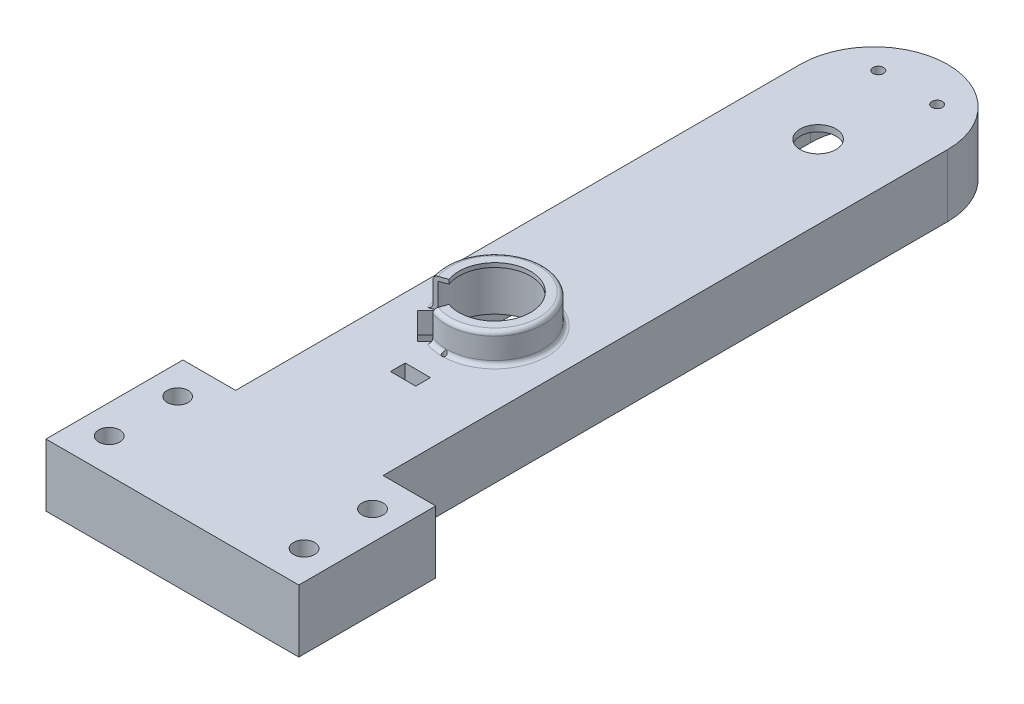
from build123d import *

# Parameters (mm, degrees)
BOSS_EXTRUDE1_DEPTH = 10
BOSS_EXTRUDE2_START = -3
SKETCH2_R           = 3.5
SKETCH2_R_2         = 7.5
BOSS_EXTRUDE2_DEPTH = 3
BOSS_EXTRUDE5_START = -3
BOSS_EXTRUDE5_DEPTH = 10
SKETCH6_R           = 8.5
CUT_EXTRUDE1_DEPTH  = 246.440929757
SKETCH7_R           = 1
CUT_EXTRUDE2_DEPTH  = 246.544802429
BOSS_EXTRUDE6_DEPTH = 22
BOSS_EXTRUDE7_DEPTH = 2
FILLET1_R           = 2
FILLET3_R           = 2
SKETCH11_W          = 12
SKETCH11_H          = 7
CUT_EXTRUDE3_DEPTH  = 247.512170095
BOSS_EXTRUDE8_START = -10
BOSS_EXTRUDE8_DEPTH = 29.65
SKETCH13_R          = 2.5
CUT_EXTRUDE4_DEPTH  = 250.845097028
SKETCH14_W          = 120
SKETCH14_H          = 65
SKETCH14_R          = 5
BOSS_EXTRUDE9_DEPTH = 29.65
SKETCH15_W          = 60
SKETCH15_H          = 55
CUT_EXTRUDE5_DEPTH  = 19.65


with BuildPart() as part:
    # Sketch1 → Boss-Extrude1 (new body)
    with BuildSketch(Plane(origin=(0, 0, 0), x_dir=(1, 0, 0), z_dir=(0, 1, 0))):
        with BuildLine():
            Line((30, 26.5), (30, -243.5))
            Line((30, -243.5), (-30, -243.5))
            Line((-30, -243.5), (-30, 26.5))
            ThreePointArc((-30, 26.5), (0, 56.5), (30, 26.5))
        make_face()
        with BuildLine():
            ThreePointArc((11.477382224, -17.586065429), (21, 0), (11.477382224, 17.586065429))
            Line((11.477382224, 17.586065429), (5.68518373, 33.5))
            Line((5.68518373, 33.5), (-5.68518373, 33.5))
            Line((-5.68518373, 33.5), (-11.477382224, 17.586065429))
            ThreePointArc((-11.477382224, 17.586065429), (-21, 0), (-11.477382224, -17.586065429))
            Line((-11.477382224, -17.586065429), (-5.68518373, -33.5))
            Line((-5.68518373, -33.5), (5.68518373, -33.5))
            Line((5.68518373, -33.5), (11.477382224, -17.586065429))
        make_face(mode=Mode.SUBTRACT)
    extrude(amount=BOSS_EXTRUDE1_DEPTH)

    # Sketch2 → Boss-Extrude2 (add)
    with BuildSketch(Plane(origin=(0, 10, 0), x_dir=(1, 0, 0), z_dir=(0, 1, 0)).offset(BOSS_EXTRUDE2_START)):
        with BuildLine():
            Line((5.68518373, 33.5), (11.477382224, 17.586065429))
            ThreePointArc((11.477382224, 17.586065429), (21, 0), (11.477382224, -17.586065429))
            Line((11.477382224, -17.586065429), (5.68518373, -33.5))
            Line((5.68518373, -33.5), (-5.68518373, -33.5))
            Line((-5.68518373, -33.5), (-11.477382224, -17.586065429))
            ThreePointArc((-11.477382224, -17.586065429), (-21, 0), (-11.477382224, 17.586065429))
            Line((-11.477382224, 17.586065429), (-5.68518373, 33.5))
            Line((-5.68518373, 33.5), (5.68518373, 33.5))
        make_face()
        with Locations(Location((0, 26.5, 0), (0, 0, 270))):
            Circle(SKETCH2_R, mode=Mode.SUBTRACT)
        with Locations(Location((0, -26.5, 0), (0, 0, 90))):
            Circle(SKETCH2_R, mode=Mode.SUBTRACT)
        with Locations(Location((0, 0, 0), (0, 0, 270))):
            Circle(SKETCH2_R_2, mode=Mode.SUBTRACT)
    extrude(amount=BOSS_EXTRUDE2_DEPTH)

    # Sketch5 → Boss-Extrude5 (add)
    with BuildSketch(Plane.XZ.offset(-7).offset(BOSS_EXTRUDE5_START)):
        with BuildLine():
            Line((11.477382224, -17.586065429), (5.68518373, -33.5))
            Line((5.68518373, -33.5), (-5.68518373, -33.5))
            Line((-5.68518373, -33.5), (-11.477382224, -17.586065429))
            ThreePointArc((-11.477382224, -17.586065429), (0, -21), (11.477382224, -17.586065429))
        make_face()
        with BuildLine():
            Line((5.68518373, 33.5), (11.477382224, 17.586065429))
            ThreePointArc((11.477382224, 17.586065429), (0, 21), (-11.477382224, 17.586065429))
            Line((-11.477382224, 17.586065429), (-5.68518373, 33.5))
            Line((-5.68518373, 33.5), (5.68518373, 33.5))
        make_face()
    extrude(amount=BOSS_EXTRUDE5_DEPTH)

    # Sketch6 → Cut-Extrude1 (cut, through all)
    with BuildSketch(Plane.XZ.offset(-7)):
        with Locations(Location((0, 0, 0), (0, 0, 270))):
            Circle(SKETCH6_R)
    extrude(amount=-CUT_EXTRUDE1_DEPTH, mode=Mode.SUBTRACT)

    # Sketch7 → Cut-Extrude2 (cut, through all)
    with BuildSketch(Plane.XZ):
        with Locations(Location((0, 129.5, 0), (0, 0, 270))):
            Circle(SKETCH7_R)
        with Locations(Location((0, 177.5, 0), (0, 0, 90))):
            Circle(SKETCH7_R)
        with BuildLine():
            Line((-12.002194303, 178.230116364), (-24.730116364, 165.502194303))
            Line((-24.730116364, 165.502194303), (-19.780368896, 160.552446834))
            ThreePointArc((-19.780368896, 160.552446834), (14.849242405, 138.650757595), (-7.052446834, 173.280368896))
            Line((-7.052446834, 173.280368896), (-12.002194303, 178.230116364))
        make_face()
    extrude(amount=-CUT_EXTRUDE2_DEPTH, mode=Mode.SUBTRACT)

    # Sketch9 → Boss-Extrude6 (add)
    with BuildSketch(Plane.XZ):
        with BuildLine():
            Line((-21.664213552, 161.224108438), (-19.780368896, 160.552446834))
            ThreePointArc((-19.780368896, 160.552446834), (14.849242405, 138.650757595), (-7.052446834, 173.280368896))
            Line((-7.052446834, 173.280368896), (-7.724108438, 175.164213552))
            ThreePointArc((-7.724108438, 175.164213552), (16.263455967, 137.236544033), (-21.664213552, 161.224108438))
        make_face()
    extrude(amount=-BOSS_EXTRUDE6_DEPTH)

    # Sketch10 → Boss-Extrude7 (add)
    with BuildSketch(Plane(origin=(0, 22, 0), x_dir=(1, 0, 0), z_dir=(0, 1, 0))):
        with BuildLine():
            Line((-21.664213552, -161.224108438), (-16.012679582, -159.209123628))
            ThreePointArc((-16.012679582, -159.209123628), (12.02081528, -141.47918472), (-5.709123628, -169.512679582))
            Line((-5.709123628, -169.512679582), (-7.724108438, -175.164213552))
            ThreePointArc((-7.724108438, -175.164213552), (16.263455967, -137.236544033), (-21.664213552, -161.224108438))
        make_face()
    extrude(amount=BOSS_EXTRUDE7_DEPTH)

    # Fillet1
    fillet1_edges = [part.edges().sort_by_distance(p)[0] for p in [
        (16.263455967, 24, 137.236544033),
    ]]
    fillet(fillet1_edges, radius=FILLET1_R)

    # Fillet3
    # the kernel refuses this fillet: 2 mm, written as the material it adds along each edge
    with BuildSketch(Plane(origin=(0, 10, 153.5), x_dir=(-2.3359514129780358e-09, 0, 1.0), z_dir=(1.0, 0, 2.3359514129780358e-09))) as fillet3_piece_1_section:
        with BuildLine():
            CenterArc((23 + FILLET3_R, -FILLET3_R), FILLET3_R, 90, 90)
            Line((23 + FILLET3_R, 0), (23, 0))
            Line((23, 0), (23, -FILLET3_R))
        make_face()
    fillet3_piece_1 = revolve(axis=Axis((0, 10, 153.5), (0, -1, 0)), revolution_arc=19.623066341, mode=Mode.PRIVATE)
    fillet3_piece_1 = fillet3_piece_1 - Plane(origin=(0, 10.450783466, 177.5), x_dir=(0, 0, 1), z_dir=(0, -1, 0)) * Cylinder(1, 101, mode=Mode.PRIVATE)
    add(fillet3_piece_1)
    with BuildSketch(Plane(origin=(0, 10, 153.5), x_dir=(-0.9419223283656014, 0, 0.3358308016342816), z_dir=(0.3358308016342816, 0, 0.9419223283656014))) as fillet3_piece_2_section:
        with BuildLine():
            CenterArc((23 + FILLET3_R, -FILLET3_R), FILLET3_R, 90, 90)
            Line((23 + FILLET3_R, 0), (23, 0))
            Line((23, 0), (23, -FILLET3_R))
        make_face()
    fillet3_piece_2 = revolve(axis=Axis((0, 10, 153.5), (0, -1, 0)), revolution_arc=109.623066475, mode=Mode.PRIVATE)
    fillet3_piece_2 = fillet3_piece_2 - Plane(origin=(0, 10.562032205, 129.5), x_dir=(0, 0, -1), z_dir=(0, -1, 0)) * Cylinder(1, 101, mode=Mode.PRIVATE)
    add(fillet3_piece_2)
    with BuildSketch(Plane(origin=(0, 10, 153.5), x_dir=(0, 0, -1), z_dir=(-1, 0, 0))) as fillet3_piece_3_section:
        with BuildLine():
            CenterArc((23 + FILLET3_R, -FILLET3_R), FILLET3_R, 90, 90)
            Line((23 + FILLET3_R, 0), (23, 0))
            Line((23, 0), (23, -FILLET3_R))
        make_face()
    fillet3_piece_3 = revolve(axis=Axis((0, 10, 153.5), (0, -1, 0)), revolution_arc=180.000000134, mode=Mode.PRIVATE)
    fillet3_piece_3 = fillet3_piece_3 - Plane(origin=(0, 10.557784065, 177.5), x_dir=(0, 0, 1), z_dir=(0, -1, 0)) * Cylinder(1, 101, mode=Mode.PRIVATE)
    fillet3_piece_3 = fillet3_piece_3 - Plane(origin=(0, 10.557784065, 129.5), x_dir=(0, 0, -1), z_dir=(0, -1, 0)) * Cylinder(1, 101, mode=Mode.PRIVATE)
    add(fillet3_piece_3)

    # Sketch11 → Cut-Extrude3 (cut, through all)
    with BuildSketch(Plane.XZ):
        with Locations((0, 193.5)):
            Rectangle(SKETCH11_W, SKETCH11_H)
    extrude(amount=-CUT_EXTRUDE3_DEPTH, mode=Mode.SUBTRACT)

    # Sketch12 → Boss-Extrude8 (add)
    with BuildSketch(Plane.XZ.offset(BOSS_EXTRUDE8_START)):
        with BuildLine():
            Line((35, 243.5), (35, -26.5))
            ThreePointArc((35, -26.5), (0, -61.5), (-35, -26.5))
            Line((-35, -26.5), (-35, 243.5))
            Line((-35, 243.5), (-30, 243.5))
            Line((-30, 243.5), (-30, -26.5))
            ThreePointArc((-30, -26.5), (-29.473014303, -32.09834153), (-27.910571474, -37.5))
            Line((-27.910571474, -37.5), (27.910571474, -37.5))
            ThreePointArc((27.910571474, -37.5), (29.473014303, -32.09834153), (30, -26.5))
            Line((30, -26.5), (30, 243.5))
            Line((30, 243.5), (35, 243.5))
        make_face()
    extrude(amount=BOSS_EXTRUDE8_DEPTH)

    # Sketch13 → Cut-Extrude4 (cut, through all)
    with BuildSketch(Plane.XZ.offset(19.65)):
        with Locations(Location((-13.955285737, -42.559356041, 0), (0, 0, 270))):
            Circle(SKETCH13_R)
        with Locations(Location((13.955285737, -42.559356041, 0), (0, 0, 90))):
            Circle(SKETCH13_R)
    extrude(amount=-CUT_EXTRUDE4_DEPTH, mode=Mode.SUBTRACT)

    # Sketch14 → Boss-Extrude9 (add)
    with BuildSketch(Plane(origin=(0, 10, 0), x_dir=(1, 0, 0), z_dir=(0, 1, 0))):
        with Locations((0, -274)):
            Rectangle(SKETCH14_W, SKETCH14_H)
        with Locations(Location((46.25, -290.25, 0), (0, 0, 270))):
            Circle(SKETCH14_R, mode=Mode.SUBTRACT)
        with Locations(Location((-46.25, -290.25, 0), (0, 0, 90))):
            Circle(SKETCH14_R, mode=Mode.SUBTRACT)
        with Locations(Location((46.25, -257.75, 0), (0, 0, 90))):
            Circle(SKETCH14_R, mode=Mode.SUBTRACT)
        with Locations(Location((-46.25, -257.75, 0), (0, 0, 270))):
            Circle(SKETCH14_R, mode=Mode.SUBTRACT)
    extrude(amount=-BOSS_EXTRUDE9_DEPTH)

    # Sketch15 → Cut-Extrude5 (cut)
    with BuildSketch(Plane.XZ.offset(19.65)):
        with Locations((0, 269)):
            Rectangle(SKETCH15_W, SKETCH15_H)
    extrude(amount=-CUT_EXTRUDE5_DEPTH, mode=Mode.SUBTRACT)


solid = part.part
